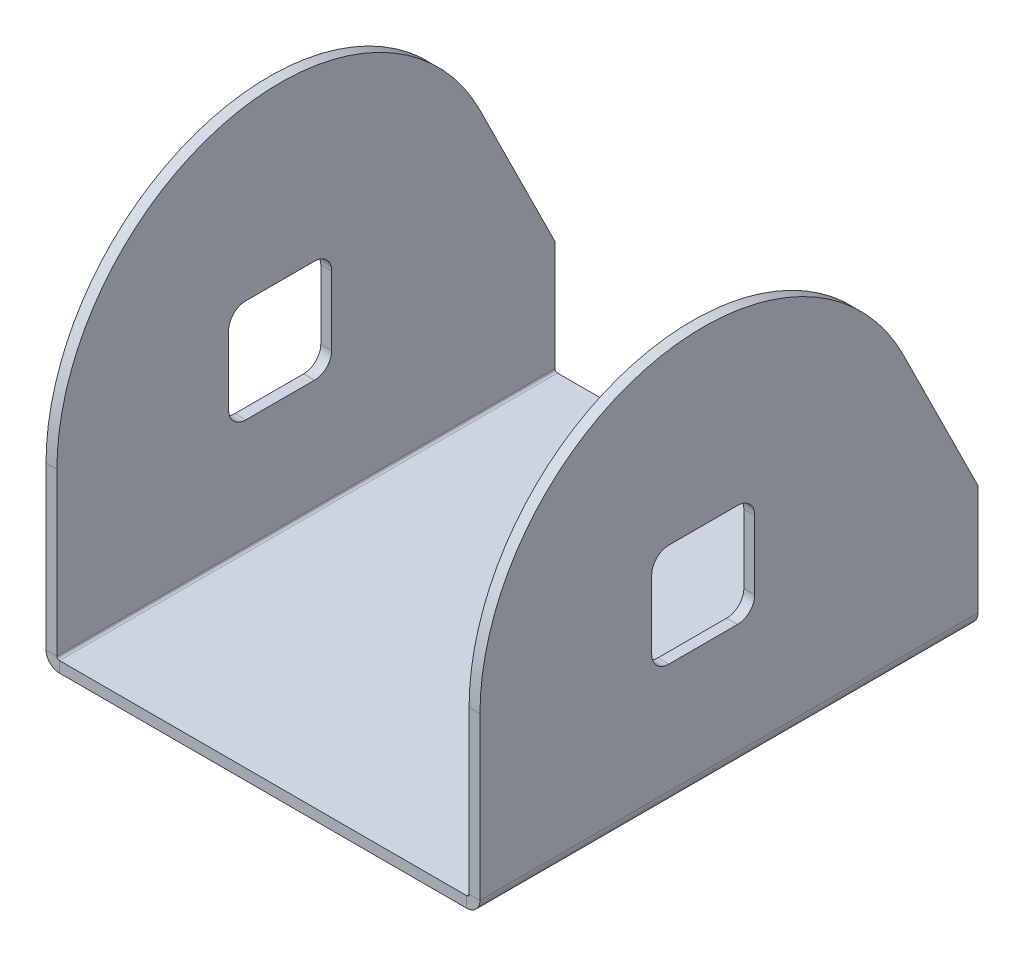
from build123d import *

# Parameters (mm, degrees)
BASE_FLANGE2_DEPTH         = 3.175
SKETCHED_START             = -176
SKETCHED_BEND3_OUTLINE_W   = 3.175
SKETCHED_BEND3_OUTLINE_H   = 145
SKETCHED_BEND3_DEPTH       = 112.825
SKETCHED_START_2           = 63.175
SKETCHED_BEND3_2_OUTLINE_W = 3.175
SKETCHED_BEND3_2_OUTLINE_H = 145
SKETCHED_BEND3_2_DEPTH     = 112.825
SKETCHED_START_3           = -62.794557784
SKETCHED_BEND3_3_DEPTH     = 2.794557784
SKETCHED_START_4           = 60
SKETCHED_BEND3_4_DEPTH     = 2.794557784
SKETCHED_START_5           = -63.175
SKETCHED_BEND3_5_DEPTH     = 3.9116
SKETCHED_START_6           = 59.2634
SKETCHED_BEND3_6_DEPTH     = 3.9116
SKETCHED_START_7           = -81
SKETCHED_BEND3_7_DEPTH     = 147


with BuildPart() as part:
    # Base-Flange2: sheet metal written as solids
    # Sketch1 → Base-Flange2 (new body)
    with BuildSketch(Plane(origin=(0, 0, 0), x_dir=(1, 0, 0), z_dir=(0, 1, 0))):
        with BuildLine():
            Line((-95, 80), (95, 80))
            Line((95, 80), (138.886329547, 58.22868679))
            ThreePointArc((138.886329547, 58.22868679), (173.284534609, -14.834678268), (110, -65))
            Line((110, -65), (-110, -65))
            ThreePointArc((-110, -65), (-173.284534609, -14.834678268), (-138.886329547, 58.22868679))
            Line((-138.886329547, 58.22868679), (-95, 80))
        make_face()
        with BuildLine():
            Line((100, -15), (120, -15))
            ThreePointArc((120, -15), (123.535533906, -13.535533906), (125, -10))
            Line((125, -10), (125, 10))
            ThreePointArc((125, 10), (123.535533906, 13.535533906), (120, 15))
            Line((120, 15), (100, 15))
            ThreePointArc((100, 15), (96.464466094, 13.535533906), (95, 10))
            Line((95, 10), (95, -10))
            ThreePointArc((95, -10), (96.464466094, -13.535533906), (100, -15))
        make_face(mode=Mode.SUBTRACT)
        with BuildLine():
            Line((-100, -15), (-120, -15))
            ThreePointArc((-120, -15), (-123.535533906, -13.535533906), (-125, -10))
            Line((-125, -10), (-125, 10))
            ThreePointArc((-125, 10), (-123.535533906, 13.535533906), (-120, 15))
            Line((-120, 15), (-100, 15))
            ThreePointArc((-100, 15), (-96.464466094, 13.535533906), (-95, 10))
            Line((-95, 10), (-95, -10))
            ThreePointArc((-95, -10), (-96.464466094, -13.535533906), (-100, -15))
        make_face(mode=Mode.SUBTRACT)
    extrude(amount=-BASE_FLANGE2_DEPTH)

    # Sketched Bend3: read off the stored shape, not the designer's step
    # Sketched Bend3 outline → Sketched Bend3 (cut)
    with BuildSketch(Plane.YZ.offset(SKETCHED_START)):
        with Locations((-1.5875, -7.5)):
            Rectangle(SKETCHED_BEND3_OUTLINE_W, SKETCHED_BEND3_OUTLINE_H)
    extrude(amount=SKETCHED_BEND3_DEPTH, mode=Mode.SUBTRACT)

    # Sketched Bend3 2 outline → Sketched Bend3 2 (cut)
    with BuildSketch(Plane.YZ.offset(SKETCHED_START_2)):
        with Locations((-1.5875, -7.5)):
            Rectangle(SKETCHED_BEND3_2_OUTLINE_W, SKETCHED_BEND3_2_OUTLINE_H)
    extrude(amount=SKETCHED_BEND3_2_DEPTH, mode=Mode.SUBTRACT)

    # Sketched Bend3 3 outline → Sketched Bend3 3 (add)
    with BuildSketch(Plane.YZ.offset(SKETCHED_START_3)):
        with BuildLine():
            Line((47.822512257, 65), (0, 65))
            Line((0, 65), (0, -80))
            Line((0, -80), (32.822512257, -80))
            Line((32.822512257, -80), (76.708841804, -58.22868679))
            ThreePointArc((76.708841804, -58.22868679), (111.107046866, 14.834678268), (47.822512257, 65))
        make_face()
        with BuildLine():
            ThreePointArc((62.822512257, -10), (61.358046163, -13.535533906), (57.822512257, -15))
            Line((57.822512257, -15), (37.822512257, -15))
            ThreePointArc((37.822512257, -15), (34.286978351, -13.535533906), (32.822512257, -10))
            Line((32.822512257, -10), (32.822512257, 10))
            ThreePointArc((32.822512257, 10), (34.286978351, 13.535533906), (37.822512257, 15))
            Line((37.822512257, 15), (57.822512257, 15))
            ThreePointArc((57.822512257, 15), (61.358046163, 13.535533906), (62.822512257, 10))
            Line((62.822512257, 10), (62.822512257, -10))
        make_face(mode=Mode.SUBTRACT)
    extrude(amount=SKETCHED_BEND3_3_DEPTH)

    # Sketched Bend3 4 outline → Sketched Bend3 4 (add)
    with BuildSketch(Plane.YZ.offset(SKETCHED_START_4)):
        with BuildLine():
            Line((47.822512257, 65), (0, 65))
            Line((0, 65), (0, -80))
            Line((0, -80), (32.822512257, -80))
            Line((32.822512257, -80), (76.708841804, -58.22868679))
            ThreePointArc((76.708841804, -58.22868679), (111.107046866, 14.834678268), (47.822512257, 65))
        make_face()
        with BuildLine():
            ThreePointArc((62.822512257, -10), (61.358046163, -13.535533906), (57.822512257, -15))
            Line((57.822512257, -15), (37.822512257, -15))
            ThreePointArc((37.822512257, -15), (34.286978351, -13.535533906), (32.822512257, -10))
            Line((32.822512257, -10), (32.822512257, 10))
            ThreePointArc((32.822512257, 10), (34.286978351, 13.535533906), (37.822512257, 15))
            Line((37.822512257, 15), (57.822512257, 15))
            ThreePointArc((57.822512257, 15), (61.358046163, 13.535533906), (62.822512257, 10))
            Line((62.822512257, 10), (62.822512257, -10))
        make_face(mode=Mode.SUBTRACT)
    extrude(amount=SKETCHED_BEND3_4_DEPTH)

    # Sketched Bend3 5 outline → Sketched Bend3 5 (add)
    with BuildSketch(Plane.YZ.offset(SKETCHED_START_5)):
        with BuildLine():
            ThreePointArc((76.708841804, -58.22868679), (111.107046866, 14.834678268), (47.822512257, 65))
            Line((47.822512257, 65), (0, 65))
            Line((0, 65), (0, -80))
            Line((0, -80), (32.822512257, -80))
            Line((32.822512257, -80), (76.708841804, -58.22868679))
        make_face()
        with BuildLine():
            ThreePointArc((62.822512257, -10), (61.358046163, -13.535533906), (57.822512257, -15))
            Line((57.822512257, -15), (37.822512257, -15))
            ThreePointArc((37.822512257, -15), (34.286978351, -13.535533906), (32.822512257, -10))
            Line((32.822512257, -10), (32.822512257, 10))
            ThreePointArc((32.822512257, 10), (34.286978351, 13.535533906), (37.822512257, 15))
            Line((37.822512257, 15), (57.822512257, 15))
            ThreePointArc((57.822512257, 15), (61.358046163, 13.535533906), (62.822512257, 10))
            Line((62.822512257, 10), (62.822512257, -10))
        make_face(mode=Mode.SUBTRACT)
    extrude(amount=SKETCHED_BEND3_5_DEPTH)

    # Sketched Bend3 6 outline → Sketched Bend3 6 (add)
    with BuildSketch(Plane.YZ.offset(SKETCHED_START_6)):
        with BuildLine():
            ThreePointArc((76.708841804, -58.22868679), (111.107046866, 14.834678268), (47.822512257, 65))
            Line((47.822512257, 65), (0, 65))
            Line((0, 65), (0, -80))
            Line((0, -80), (32.822512257, -80))
            Line((32.822512257, -80), (76.708841804, -58.22868679))
        make_face()
        with BuildLine():
            ThreePointArc((62.822512257, -10), (61.358046163, -13.535533906), (57.822512257, -15))
            Line((57.822512257, -15), (37.822512257, -15))
            ThreePointArc((37.822512257, -15), (34.286978351, -13.535533906), (32.822512257, -10))
            Line((32.822512257, -10), (32.822512257, 10))
            ThreePointArc((32.822512257, 10), (34.286978351, 13.535533906), (37.822512257, 15))
            Line((37.822512257, 15), (57.822512257, 15))
            ThreePointArc((57.822512257, 15), (61.358046163, 13.535533906), (62.822512257, 10))
            Line((62.822512257, 10), (62.822512257, -10))
        make_face(mode=Mode.SUBTRACT)
    extrude(amount=SKETCHED_BEND3_6_DEPTH)

    # Sketched Bend3 7 outline → Sketched Bend3 7 (cut)
    with BuildSketch(Plane.XY.offset(SKETCHED_START_7)):
        with BuildLine():
            Line((-65, -3.175000031), (-59.2634, -3.175))
            ThreePointArc((-59.2634, -3.175), (-62.029318885, -2.029318885), (-63.175, 0.7366))
            Line((-63.175, 0.7366), (-63.175000008, 32.822512257))
            Line((-63.175000008, 32.822512257), (-65, 32.822512257))
            Line((-65, 32.822512257), (-65, -3.175000031))
        make_face()
        with BuildLine():
            ThreePointArc((63.175, 0.7366), (62.029318885, -2.029318885), (59.2634, -3.175))
            Line((59.2634, -3.175), (65, -3.175000031))
            Line((65, -3.175000031), (65, 32.822512257))
            Line((65, 32.822512257), (63.175, 32.822512257))
            Line((63.175, 32.822512257), (63.175, 0.7366))
        make_face()
        with BuildLine():
            Line((-59.2634, 0), (-59.2634, 114))
            Line((-59.2634, 114), (-60, 114))
            Line((-60, 114), (-60, 0.7366))
            ThreePointArc((-60, 0.7366), (-59.784254855, 0.215745145), (-59.2634, 0))
        make_face()
        with BuildLine():
            ThreePointArc((59.2634, 0), (59.784254855, 0.215745145), (60, 0.7366))
            Line((60, 0.7366), (60, 114))
            Line((60, 114), (59.2634, 114))
            Line((59.2634, 114), (59.2634, 0))
        make_face()
    extrude(amount=SKETCHED_BEND3_7_DEPTH, mode=Mode.SUBTRACT)


solid = part.part
